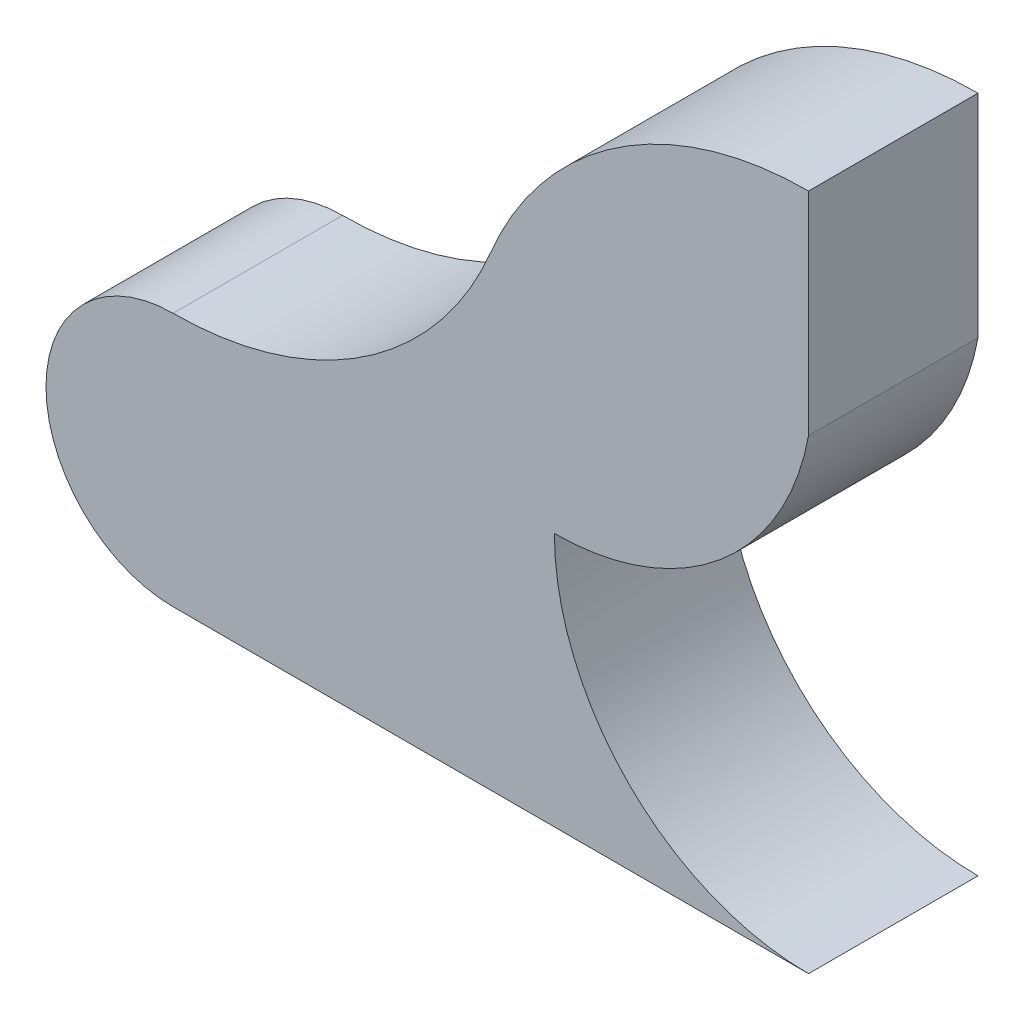
from build123d import *

# Parameters (mm, degrees)
BOSS_EXTRUDE1_DEPTH = 10
SHELL1_T            = -1
BOSS_EXTRUDE2_DEPTH = 10
BOSS_EXTRUDE3_DEPTH = 10
SHELL3_START        = -10
SHELL3_DEPTH        = 9


# Read off the part's stored shape, not the designer's step: Shell3
with BuildPart() as part:
    # Sketch2 → Boss-Extrude1 (new body)
    with BuildSketch(Plane.XY):
        with BuildLine():
            Line((-11.25, 7.5), (11.25, 7.5))
            ThreePointArc((11.25, 7.5), (15.643398282, -3.106601718), (26.25, -7.5))
            Line((26.25, -7.5), (11.25, -7.5))
            Line((11.25, -7.5), (-11.25, -7.5))
            ThreePointArc((-11.25, -7.5), (-18.75, 0), (-11.25, 7.5))
        make_face()
    extrude(amount=-BOSS_EXTRUDE1_DEPTH)

    # Shell1
    shell1_openings = [part.faces().sort_by_distance(p)[0] for p in [
        (-1.202754878, -0.422571934, -10),
    ]]
    offset(amount=SHELL1_T, openings=shell1_openings, kind=Kind.INTERSECTION)

    # Sketch3 → Boss-Extrude2 (add)
    with BuildSketch(Plane.XY):
        Polygon((13.259618943, -5.5), (-11.25, -5.5), (-11.25, -6.5), (-11.25, -7.5), (13.259618943, -7.5), (13.259618943, -6.56903326), align=None)
    extrude(amount=-BOSS_EXTRUDE2_DEPTH)

    # Sketch6 → Boss-Extrude3 (add)
    with BuildSketch(Plane(origin=(0, 0, -10), x_dir=(-1, 0, 0), z_dir=(0, 0, -1))):
        with BuildLine():
            Line((-26.25, 20), (-26.25, 32.5))
            ThreePointArc((-26.25, 32.5), (-14.982652264, 29.088521604), (-7.5, 20))
            ThreePointArc((-7.5, 20), (-0.017347736, 10.911478396), (11.25, 7.5))
            Line((11.25, 7.5), (-11.25, 7.5))
            ThreePointArc((-11.25, 7.5), (-21.012812095, 11.034625486), (-26.25, 20))
        make_face()
    extrude(amount=-BOSS_EXTRUDE3_DEPTH)

    # Shell3 outline → Shell3 (cut)
    with BuildSketch(Plane.XY.offset(SHELL3_START)):
        with BuildLine():
            ThreePointArc((10.25, 7.5), (10.258344649, 8.016680893), (10.283369893, 8.532822846))
            ThreePointArc((10.283369893, 8.532822846), (19.960539936, 11.472190194), (25.25, 20.092463547))
            Line((25.25, 20.092463547), (25.25, 31.474092655))
            ThreePointArc((25.25, 31.474092655), (15.124781026, 27.973638192), (8.423076923, 19.615384615))
            ThreePointArc((8.423076923, 19.615384615), (3.148687527, 12.099433662), (-4.79825605, 7.5))
            Line((-4.79825605, 7.5), (10.25, 7.5))
        make_face()
    extrude(amount=SHELL3_DEPTH, mode=Mode.SUBTRACT)


solid = part.part
